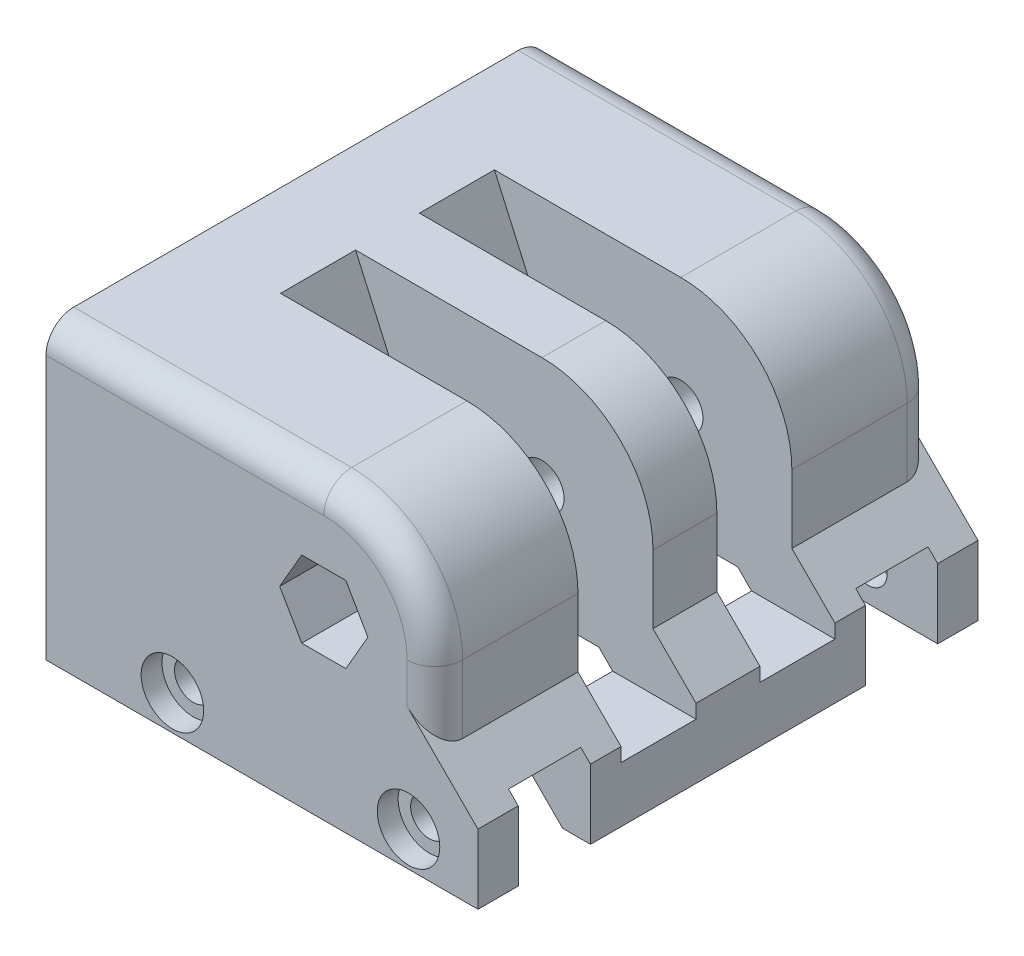
from build123d import *

# Parameters (mm, degrees)
BOSS_EXTRUDE1_DEPTH   = 18
CROQUIS2_R            = 1.35
CORTAR_EXTRUIR2_DEPTH = 5
SKETCH3_R             = 2.25
CUT_EXTRUDE1_DEPTH    = 1.5
SKETCH5_W             = 5.2
SKETCH5_H             = 5.7
CUT_EXTRUDE2_DEPTH    = 39.212694226
CUT_EXTRUDE3_START    = -15.7
CUT_EXTRUDE3_DEPTH    = 5.4
CROQUIS1_R            = 1.6
CORTAR_EXTRUIR1_DEPTH = 30.883105595
CUT_EXTRUDE7_DEPTH    = 5
SKETCH7_W             = 24.1
SKETCH7_H             = 19.8
CUT_EXTRUDE4_DEPTH    = 5
FILLET5_R             = 2
CHAFL_N1_SIZE         = 5


with BuildPart() as part:
    # Sketch1 → Boss-Extrude1 (new body)
    with BuildSketch(Plane.XY):
        with BuildLine():
            Line((-20, 5.553828843), (-20, -8))
            Line((-20, -8), (-20, -13))
            Line((-20, -13), (11.1, -13))
            Line((11.1, -13), (11.1, -8))
            Line((11.1, -8), (8, -4.9))
            Line((8, -4.9), (8, 0))
            ThreePointArc((8, 0), (5.656854249, 5.656854249), (0, 8))
            Line((0, 8), (-20, 8))
            Line((-20, 8), (-20, 5.553828843))
        make_face()
    boss_extrude1 = extrude(amount=BOSS_EXTRUDE1_DEPTH)

    # Croquis2 → Cortar-Extruir2 (cut)
    with BuildSketch(Plane.XY.offset(18)):
        with Locations((-10.9, -10.5)):
            Circle(CROQUIS2_R)
        with Locations((6.1, -10.5)):
            Circle(CROQUIS2_R)
    cortar_extruir2 = extrude(amount=-CORTAR_EXTRUIR2_DEPTH, mode=Mode.SUBTRACT)

    # Sketch3 → Cut-Extrude1 (cut)
    with BuildSketch(Plane.XY.offset(18)):
        with Locations((-10.9, -10.5)):
            Circle(SKETCH3_R)
        with Locations((6.1, -10.5)):
            Circle(SKETCH3_R)
    cut_extrude1 = extrude(amount=-CUT_EXTRUDE1_DEPTH, mode=Mode.SUBTRACT)

    # Sketch5 → Cut-Extrude2 (cut, through all)
    with BuildSketch(Plane(origin=(11.1, 0, 0), x_dir=(0, 0, -1), z_dir=(1, 0, 0))):
        with Locations((-12.5, -10.15)):
            Rectangle(SKETCH5_W, SKETCH5_H)
    cut_extrude2 = extrude(amount=-CUT_EXTRUDE2_DEPTH, mode=Mode.SUBTRACT)

    # Sketch6 → Cut-Extrude3 (cut)
    with BuildSketch(Plane.XY.offset(18).offset(CUT_EXTRUDE3_START)):
        with BuildLine():
            Line((-13.413555989, 8), (-8.221909119, -3.660629788))
            ThreePointArc((-8.221909119, -3.660629788), (-4.901751315, -7.548035112), (0, -9))
            Line((0, -9), (14.43375673, -9))
            Line((14.43375673, -9), (6.92820323, 4))
            ThreePointArc((6.92820323, 4), (4, 6.92820323), (0, 8))
            Line((0, 8), (-13.413555989, 8))
        make_face()
    cut_extrude3 = extrude(amount=CUT_EXTRUDE3_DEPTH, mode=Mode.SUBTRACT)

    # Croquis1 → Cortar-Extruir1 (cut, through all)
    with BuildSketch(Plane(origin=(0, 0, 0), x_dir=(-1, 0, 0), z_dir=(0, 0, -1))):
        Circle(CROQUIS1_R)
    cortar_extruir1 = extrude(amount=-CORTAR_EXTRUIR1_DEPTH, mode=Mode.SUBTRACT)

    # Sketch10 → Cut-Extrude7 (cut)
    with BuildSketch(Plane.XY.offset(18)):
        Polygon((3.175426481, 0), (1.58771324, 2.75), (-1.58771324, 2.75), (-3.175426481, 0), (-1.58771324, -2.75), (1.58771324, -2.75), align=None)
    cut_extrude7 = extrude(amount=-CUT_EXTRUDE7_DEPTH, mode=Mode.SUBTRACT)

    # Mirror1: Boss-Extrude1, Cortar-Extruir2, Cut-Extrude1, Cut-Extrude2, Cut-Extrude3, Cortar-Extruir1, Cut-Extrude7 across plane
    add(boss_extrude1.mirror(Plane(origin=(0, 0, 0), x_dir=(1, 0, 0), z_dir=(0, 0, -1))))
    add(cortar_extruir2.mirror(Plane(origin=(0, 0, 0), x_dir=(1, 0, 0), z_dir=(0, 0, -1))), mode=Mode.SUBTRACT)
    add(cut_extrude1.mirror(Plane(origin=(0, 0, 0), x_dir=(1, 0, 0), z_dir=(0, 0, -1))), mode=Mode.SUBTRACT)
    add(cut_extrude2.mirror(Plane(origin=(0, 0, 0), x_dir=(1, 0, 0), z_dir=(0, 0, -1))), mode=Mode.SUBTRACT)
    add(cut_extrude3.mirror(Plane(origin=(0, 0, 0), x_dir=(1, 0, 0), z_dir=(0, 0, -1))), mode=Mode.SUBTRACT)
    add(cortar_extruir1.mirror(Plane(origin=(0, 0, 0), x_dir=(1, 0, 0), z_dir=(0, 0, -1))), mode=Mode.SUBTRACT)
    add(cut_extrude7.mirror(Plane(origin=(0, 0, 0), x_dir=(1, 0, 0), z_dir=(0, 0, -1))), mode=Mode.SUBTRACT)

    # Sketch7 → Cut-Extrude4 (cut)
    with BuildSketch(Plane.XZ.offset(13)):
        with Locations((-7.95, 0)):
            Rectangle(SKETCH7_W, SKETCH7_H)
    extrude(amount=-CUT_EXTRUDE4_DEPTH, mode=Mode.SUBTRACT)

    # Fillet5
    fillet5_edges = [part.edges().sort_by_distance(p)[0] for p in [
        (5.656854249, 5.656854249, 18),
        (-10, 8, 18),
        (-10, 8, -18),
        (5.656854249, 5.656854249, -18),
        (8, -2.45, -18),
        (8, -2.45, 18),
    ]]
    fillet(fillet5_edges, radius=FILLET5_R)

    # Chaflán1
    # the kernel refuses this chamfer: 5 mm, written as the material it takes off along each edge
    with BuildSketch(Plane(origin=(4.1, -13, 22.75841494), x_dir=(0.9996219169112968, -0.027495876610586317, 0), z_dir=(0, 0, -1))) as chafl_n1_piece_1_section:
        Polygon((CHAFL_N1_SIZE * 0.999621916911, -CHAFL_N1_SIZE * 0.0274958766106), (-CHAFL_N1_SIZE * 0.0274958766106, -CHAFL_N1_SIZE * 0.999621916911), (0, 0), align=None)
    chafl_n1_piece_1 = extrude(amount=45.51682988, mode=Mode.PRIVATE)
    chafl_n1_piece_1 = split(chafl_n1_piece_1, bisect_by=Plane(origin=(8.49756634, -12.423659296, -15.1), z_dir=(0, 0, 1)), keep=Keep.TOP, mode=Mode.PRIVATE)
    chafl_n1_piece_1 = split(chafl_n1_piece_1, bisect_by=Plane(origin=(8.49756634, -12.423659296, 15.1), z_dir=(0, 0, -1)), keep=Keep.TOP, mode=Mode.PRIVATE)
    add(chafl_n1_piece_1, mode=Mode.SUBTRACT)


solid = part.part
